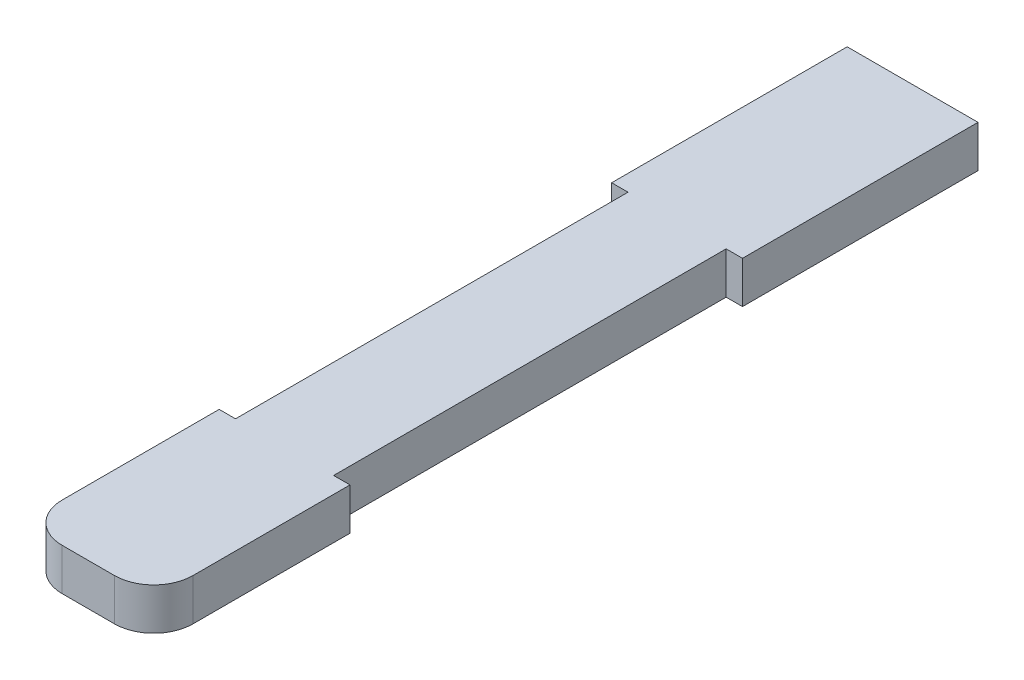
from build123d import *

# Parameters (mm, degrees)
SKETCH1_W           = 10
SKETCH1_H           = 63
BOSS_EXTRUDE1_DEPTH = 3.2
FILLET1_R           = 3
CUT_EXTRUDE1_REACH  = 34.054
SKETCH2_W           = 1.25
SKETCH2_H           = 30


with BuildPart() as part:
    # Sketch1 → Boss-Extrude1 (new body)
    with BuildSketch(Plane(origin=(0, 0, 0), x_dir=(1, 0, 0), z_dir=(0, 1, 0))):
        Rectangle(SKETCH1_W, SKETCH1_H)
    extrude(amount=-BOSS_EXTRUDE1_DEPTH)

    # Fillet1
    fillet1_edges = [part.edges().sort_by_distance(p)[0] for p in [
        (-5, -1.6, 31.5),
        (5, -1.6, 31.5),
    ]]
    fillet(fillet1_edges, radius=FILLET1_R)

    # Sketch2 → Cut-Extrude1 (cut, up to next)
    with BuildSketch(Plane(origin=(0, 0, 0), x_dir=(1, 0, 0), z_dir=(0, 1, 0)), mode=Mode.PRIVATE) as cut_extrude1_sk1:
        with Locations((-4.375, -1.5)):
            Rectangle(SKETCH2_W, SKETCH2_H)
    cut_extrude1_tool1 = extrude(cut_extrude1_sk1.sketch, amount=-CUT_EXTRUDE1_REACH, mode=Mode.PRIVATE) & part.part
    # Sketch2 → Cut-Extrude1 (cut, up to next)
    with BuildSketch(Plane(origin=(0, 0, 0), x_dir=(1, 0, 0), z_dir=(0, 1, 0)), mode=Mode.PRIVATE) as cut_extrude1_sk2:
        with Locations((4.375, -1.5)):
            Rectangle(SKETCH2_W, SKETCH2_H)
    cut_extrude1_tool2 = extrude(cut_extrude1_sk2.sketch, amount=-CUT_EXTRUDE1_REACH, mode=Mode.PRIVATE) & part.part
    add(cut_extrude1_tool1.solids().sort_by_distance((-4.375, 0, 1.5))[0], mode=Mode.SUBTRACT)
    add(cut_extrude1_tool2.solids().sort_by_distance((4.375, 0, 1.5))[0], mode=Mode.SUBTRACT)


solid = part.part
